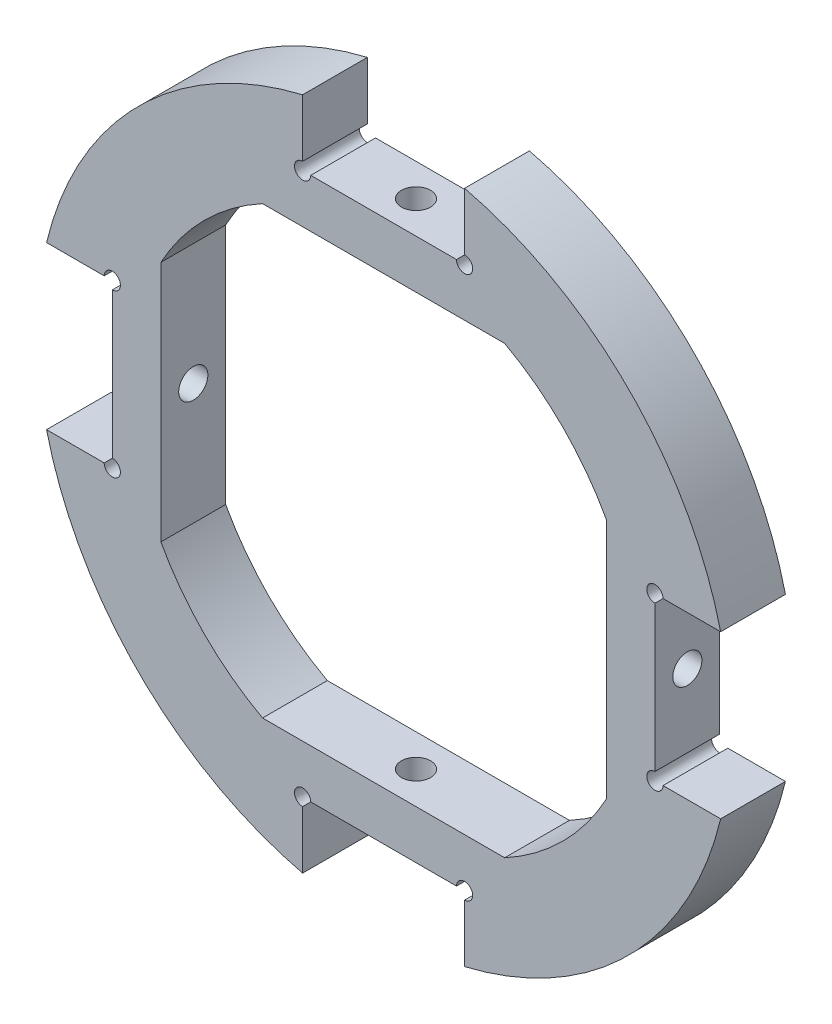
from build123d import *

# Parameters (mm, degrees)
EXTRUDE_1_DEPTH          = 4
SKETCH_2_R               = 0.9
CUT_EXTRUDE_1_DEPTH      = 43
PATTERN_CIRCULAR_1_COUNT = 4


with BuildPart() as part:
    # 草图1 → 凸台-拉伸1 (new body)
    with BuildSketch(Plane.XY):
        with BuildLine():
            Line((-4.5, 16.75), (4.5, 16.75))
            ThreePointArc((4.5, 16.75), (5.353553391, 16.396446609), (5, 17.25))
            Line((5, 17.25), (5, 20.807690886))
            ThreePointArc((5, 20.807690886), (15.132085117, 15.132085117), (20.807690886, 5))
            Line((20.807690886, 5), (17.25, 5))
            ThreePointArc((17.25, 5), (16.396446609, 5.353553391), (16.75, 4.5))
            Line((16.75, 4.5), (16.75, -4.5))
            ThreePointArc((16.75, -4.5), (16.396446609, -5.353553391), (17.25, -5))
            Line((17.25, -5), (20.807690886, -5))
            ThreePointArc((20.807690886, -5), (15.132085117, -15.132085117), (5, -20.807690886))
            Line((5, -20.807690886), (5, -17.25))
            ThreePointArc((5, -17.25), (5.353553391, -16.396446609), (4.5, -16.75))
            Line((4.5, -16.75), (-4.5, -16.75))
            ThreePointArc((-4.5, -16.75), (-5.353553391, -16.396446609), (-5, -17.25))
            Line((-5, -17.25), (-5, -20.807690886))
            ThreePointArc((-5, -20.807690886), (-15.132085117, -15.132085117), (-20.807690886, -5))
            Line((-20.807690886, -5), (-17.25, -5))
            ThreePointArc((-17.25, -5), (-16.396446609, -5.353553391), (-16.75, -4.5))
            Line((-16.75, -4.5), (-16.75, 4.5))
            ThreePointArc((-16.75, 4.5), (-16.396446609, 5.353553391), (-17.25, 5))
            Line((-17.25, 5), (-20.807690886, 5))
            ThreePointArc((-20.807690886, 5), (-15.132085117, 15.132085117), (-5, 20.807690886))
            Line((-5, 20.807690886), (-5, 17.25))
            ThreePointArc((-5, 17.25), (-5.353553391, 16.396446609), (-4.5, 16.75))
        make_face()
        with BuildLine():
            Line((-7.473954776, -13.75), (7.473954776, -13.75))
            ThreePointArc((7.473954776, -13.75), (11.066221126, -11.066221126), (13.75, -7.473954776))
            Line((13.75, -7.473954776), (13.75, 7.473954776))
            ThreePointArc((13.75, 7.473954776), (11.066221126, 11.066221126), (7.473954776, 13.75))
            Line((7.473954776, 13.75), (-7.473954776, 13.75))
            ThreePointArc((-7.473954776, 13.75), (-11.066221126, 11.066221126), (-13.75, 7.473954776))
            Line((-13.75, 7.473954776), (-13.75, -7.473954776))
            ThreePointArc((-13.75, -7.473954776), (-11.066221126, -11.066221126), (-7.473954776, -13.75))
        make_face(mode=Mode.SUBTRACT)
    extrude(amount=EXTRUDE_1_DEPTH)

    # 草图2 → 切除-拉伸1 (cut)
    with BuildSketch(Plane(origin=(0, 16.75, 0), x_dir=(1, 0, 0), z_dir=(0, 1, 0))):
        with Locations((0, -2)):
            Circle(SKETCH_2_R)
    cut_extrude_1 = extrude(amount=-CUT_EXTRUDE_1_DEPTH, mode=Mode.SUBTRACT)

    # 阵列(圆周)1: 切除-拉伸1 ×4 about axis
    pattern_circular_1_axis = Axis((0, 0, 4), (0, 0, -1))
    for i in range(1, PATTERN_CIRCULAR_1_COUNT):
        add(cut_extrude_1.rotate(pattern_circular_1_axis, i * 360 / PATTERN_CIRCULAR_1_COUNT), mode=Mode.SUBTRACT)


solid = part.part
